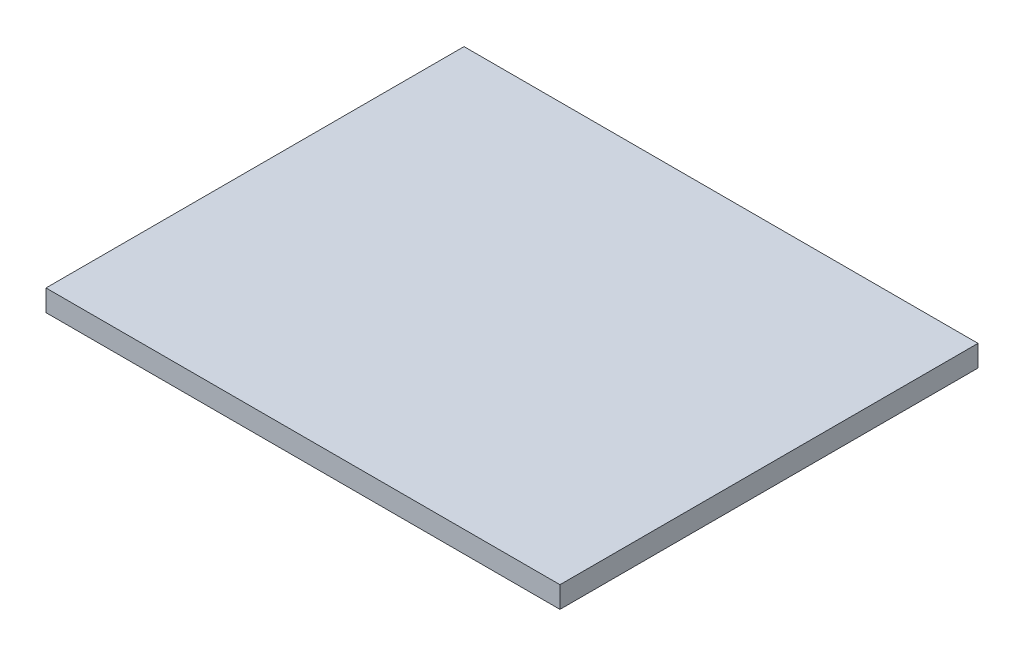
from build123d import *

# Parameters (mm, degrees)
SKETCH1_W           = 152.4
SKETCH1_H           = 123.952
BOSS_EXTRUDE1_DEPTH = 6.35


with BuildPart() as part:
    # Sketch1 → Boss-Extrude1 (new body)
    with BuildSketch(Plane(origin=(0, 0, 0), x_dir=(1, 0, 0), z_dir=(0, 1, 0))):
        with Locations((10.254658385, 17.249913043)):
            Rectangle(SKETCH1_W, SKETCH1_H)
    extrude(amount=BOSS_EXTRUDE1_DEPTH)


solid = part.part
